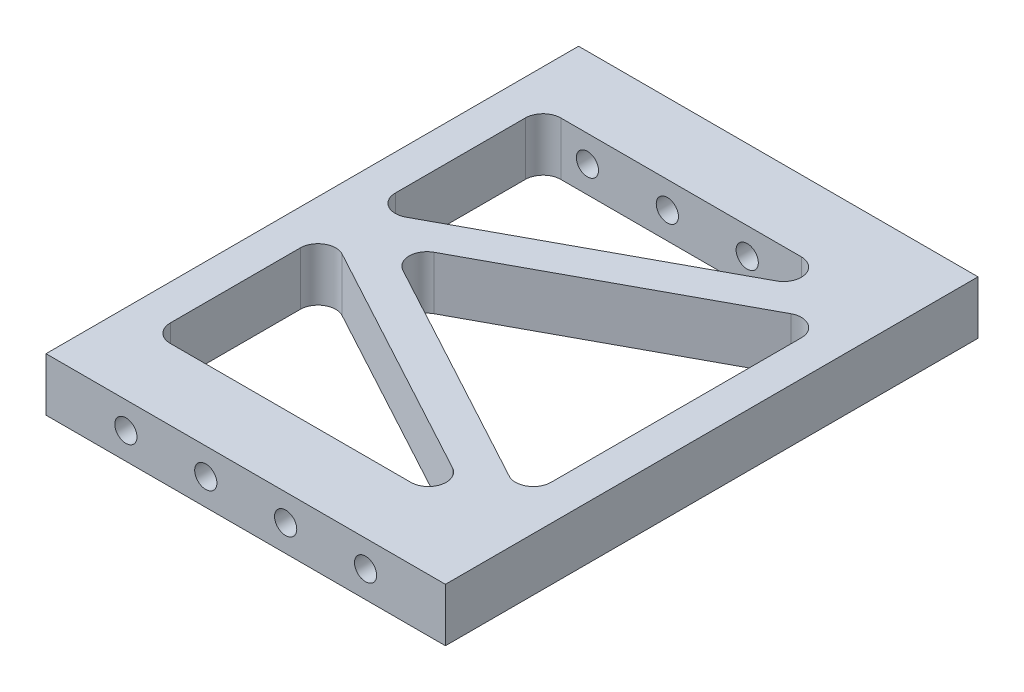
from build123d import *

# Parameters (mm, degrees)
SKETCH_1_W          = 45
SKETCH_1_H          = 60
EXTRUDE_1_DEPTH     = 6
CUT_EXTRUDE_2_DEPTH = 65.360313859
FILLET_10_R         = 2
M3X0_52_D           = 2.5
M3X0_52_DEPTH       = 8.5
M3X0_52_TIP         = 0.751075774
M3X0_51_D           = 2.5
M3X0_51_DEPTH       = 8.5
M3X0_51_TIP         = 0.751075774


with BuildPart() as part:
    # Эскиз1 → Бобышка-Вытянуть1 (new body)
    with BuildSketch(Plane(origin=(0, 0, 0), x_dir=(1, 0, 0), z_dir=(0, 1, 0))):
        with Locations((0, -30)):
            Rectangle(SKETCH_1_W, SKETCH_1_H)
    extrude(amount=EXTRUDE_1_DEPTH)

    # Эскиз13 → Вырез-Вытянуть2 (cut, through all)
    with BuildSketch(Plane(origin=(0, 6, 0), x_dir=(1, 0, 0), z_dir=(0, 1, 0))):
        Polygon((-18.5, -8), (18.5, -8), (-18.5, -28), align=None)
        Polygon((18.5, -52), (-18.5, -32), (-18.5, -52), align=None)
        Polygon((18.5, -12.546970993), (-13.788103662, -30), (18.5, -47.453029007), align=None)
    extrude(amount=-CUT_EXTRUDE_2_DEPTH, mode=Mode.SUBTRACT)

    # Скругление10
    fillet_10_edges = [part.edges().sort_by_distance(p)[0] for p in [
        (-13.788103662, 3, 30),
        (18.5, 3, 12.546970993),
        (18.5, 3, 47.453029007),
        (18.5, 3, 52),
        (-18.5, 3, 52),
        (-18.5, 3, 32),
        (18.5, 3, 8),
        (-18.5, 3, 8),
        (-18.5, 3, 28),
    ]]
    fillet(fillet_10_edges, radius=FILLET_10_R)

    # Отверстие обработанное метчиком M3x0.52
    with Locations(Plane(origin=(0, 0, 0), x_dir=(-1, 0, 0), z_dir=(0, 0, -1))):
        with Locations((-13.5, 3), (-4.5, 3), (4.5, 3), (13.5, 3)):
            Hole(M3X0_52_D / 2, depth=M3X0_52_DEPTH)
            with Locations((0, 0, -(M3X0_52_DEPTH + M3X0_52_TIP / 2))):  # 118° drill point
                Cone(0, M3X0_52_D / 2, M3X0_52_TIP, mode=Mode.SUBTRACT)

    # Отверстие обработанное метчиком M3x0.51
    with Locations(Plane.XY.offset(60)):
        with Locations((-13.5, 3), (-4.5, 3), (4.5, 3), (13.5, 3)):
            Hole(M3X0_51_D / 2, depth=M3X0_51_DEPTH)
            with Locations((0, 0, -(M3X0_51_DEPTH + M3X0_51_TIP / 2))):  # 118° drill point
                Cone(0, M3X0_51_D / 2, M3X0_51_TIP, mode=Mode.SUBTRACT)


solid = part.part
